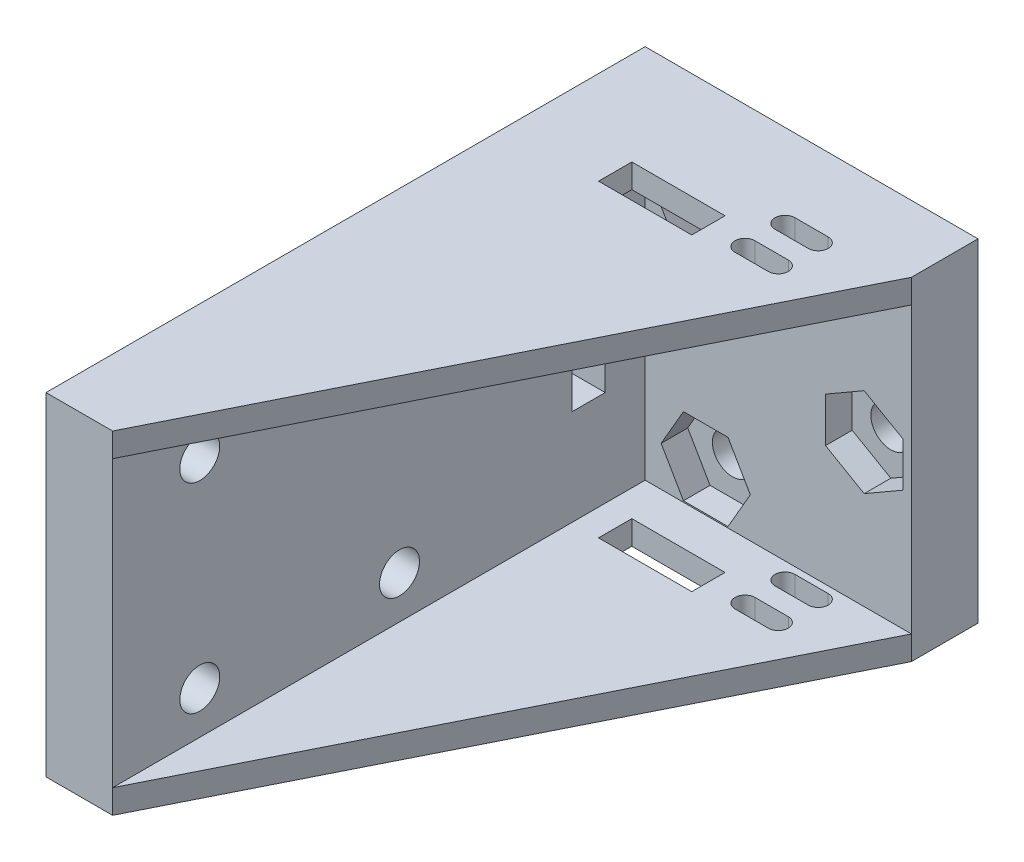
from build123d import *

# Parameters (mm, degrees)
SKETCH1_W           = 25
SKETCH1_H           = 25
SKETCH1_R           = 1.5
BOSS_EXTRUDE1_DEPTH = 5
SKETCH2_W           = 5
SKETCH2_H           = 25
BOSS_EXTRUDE2_DEPTH = 40
CUT_EXTRUDE1_DEPTH  = 2
BOSS_EXTRUDE3_DEPTH = 1.8
BOSS_EXTRUDE4_DEPTH = 1.8
SKETCH6_W           = 7
SKETCH6_H           = 2.5
CUT_EXTRUDE2_DEPTH  = 69.489273795
SKETCH7_W           = 2.5
SKETCH7_H           = 7
CUT_EXTRUDE3_DEPTH  = 51.806003582
CUT_EXTRUDE4_DEPTH  = 69.489273795
SKETCH9_R           = 1.5
CUT_EXTRUDE5_DEPTH  = 53.974050251


with BuildPart() as part:
    # Sketch1 → Boss-Extrude1 (new body)
    with BuildSketch(Plane.XY):
        with Locations((-32.675, 0)):
            Rectangle(SKETCH1_W, SKETCH1_H)
        with Locations((-35.625, 7.7)):
            Circle(SKETCH1_R, mode=Mode.SUBTRACT)
        with Locations((-35.625, -7.7)):
            Circle(SKETCH1_R, mode=Mode.SUBTRACT)
        with Locations((-23.725, 0)):
            Circle(SKETCH1_R, mode=Mode.SUBTRACT)
    extrude(amount=BOSS_EXTRUDE1_DEPTH)

    # Sketch2 → Boss-Extrude2 (add)
    with BuildSketch(Plane.XY.offset(5)):
        with Locations((-42.675, 0)):
            Rectangle(SKETCH2_W, SKETCH2_H)
    extrude(amount=BOSS_EXTRUDE2_DEPTH)

    # Sketch3 → Cut-Extrude1 (cut)
    with BuildSketch(Plane.XY.offset(5)):
        Polygon((-37.299315781, 4.8), (-33.950684219, 4.8), (-32.276368439, 7.7), (-33.950684219, 10.6), (-37.299315781, 10.6), (-38.973631561, 7.7), align=None)
        Polygon((-33.950684219, -4.8), (-37.299315781, -4.8), (-38.973631561, -7.7), (-37.299315781, -10.6), (-33.950684219, -10.6), (-32.276368439, -7.7), align=None)
        Polygon((-23.725, -3.348631561), (-20.825, -1.674315781), (-20.825, 1.674315781), (-23.725, 3.348631561), (-26.625, 1.674315781), (-26.625, -1.674315781), align=None)
    extrude(amount=-CUT_EXTRUDE1_DEPTH, mode=Mode.SUBTRACT)

    # Sketch4 → Boss-Extrude3 (add)
    with BuildSketch(Plane.XZ.offset(12.5)):
        Polygon((-40.175, 45), (-20.175, 5), (-40.175, 5), align=None)
    extrude(amount=-BOSS_EXTRUDE3_DEPTH)

    # Sketch5 → Boss-Extrude4 (add)
    with BuildSketch(Plane(origin=(0, 12.5, 0), x_dir=(1, 0, 0), z_dir=(0, 1, 0))):
        Polygon((-40.175, -45), (-20.175, -5), (-40.175, -5), align=None)
    extrude(amount=-BOSS_EXTRUDE4_DEPTH)

    # Sketch6 → Cut-Extrude2 (cut, through all)
    with BuildSketch(Plane(origin=(0, 12.5, 0), x_dir=(1, 0, 0), z_dir=(0, 1, 0))):
        with Locations((-34.675, -9.25)):
            Rectangle(SKETCH6_W, SKETCH6_H)
    extrude(amount=-CUT_EXTRUDE2_DEPTH, mode=Mode.SUBTRACT)

    # Sketch7 → Cut-Extrude3 (cut, through all)
    with BuildSketch(Plane(origin=(-40.175, 0, 0), x_dir=(0, 0, -1), z_dir=(1, 0, 0))):
        with Locations((-9.25, 0)):
            Rectangle(SKETCH7_W, SKETCH7_H)
    extrude(amount=-CUT_EXTRUDE3_DEPTH, mode=Mode.SUBTRACT)

    # Sketch8 → Cut-Extrude4 (cut, through all)
    with BuildSketch(Plane.XZ.offset(12.5)):
        with BuildLine():
            Line((-25.925, 7), (-28.425, 7))
            ThreePointArc((-28.425, 7), (-29.175, 6.25), (-28.425, 5.5))
            Line((-28.425, 5.5), (-25.925, 5.5))
            ThreePointArc((-25.925, 5.5), (-25.175, 6.25), (-25.925, 7))
        make_face()
        with BuildLine():
            Line((-28.425, 8.5), (-25.925, 8.5))
            ThreePointArc((-25.925, 8.5), (-25.175, 9.25), (-25.925, 10))
            Line((-25.925, 10), (-28.425, 10))
            ThreePointArc((-28.425, 10), (-29.175, 9.25), (-28.425, 8.5))
        make_face()
    extrude(amount=-CUT_EXTRUDE4_DEPTH, mode=Mode.SUBTRACT)

    # Sketch9 → Cut-Extrude5 (cut, through all)
    with BuildSketch(Plane.ZY.offset(45.175)):
        with Locations((23.45, 7.5)):
            Circle(SKETCH9_R)
        with Locations((23.45, -7.5)):
            Circle(SKETCH9_R)
        with Locations((38.45, 7.5)):
            Circle(SKETCH9_R)
        with Locations((38.45, -7.5)):
            Circle(SKETCH9_R)
    extrude(amount=-CUT_EXTRUDE5_DEPTH, mode=Mode.SUBTRACT)


solid = part.part
